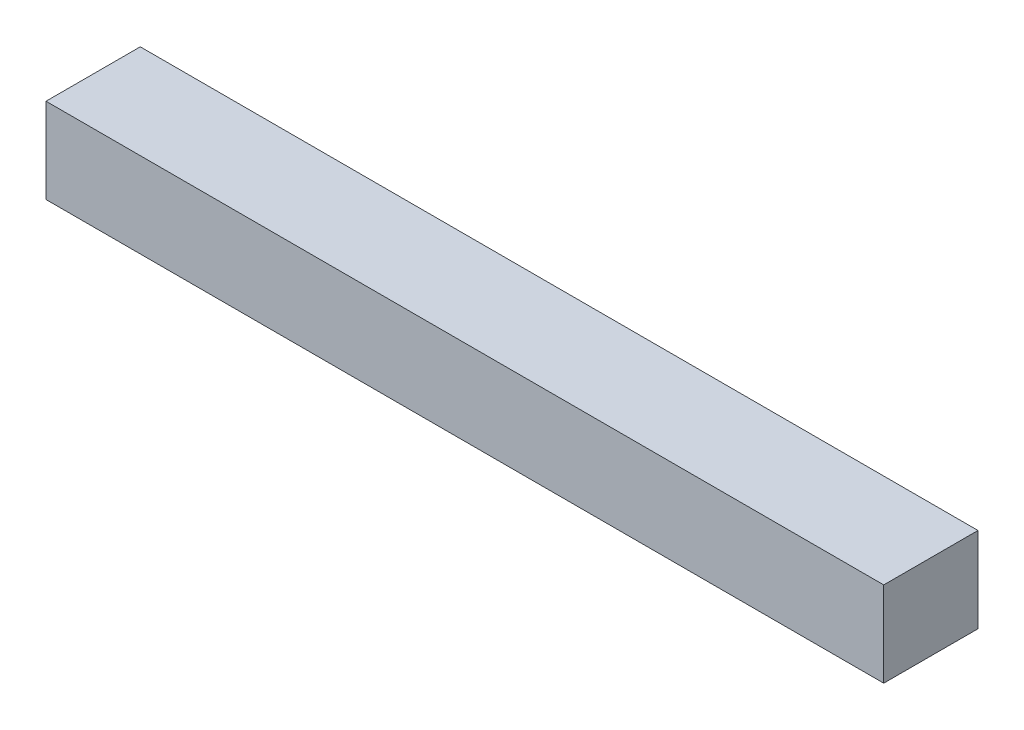
from build123d import *

# Parameters (mm, degrees)
SKETCH_1_W          = 275.5
SKETCH_1_H          = 31
EXTRUDE_1_DEPTH     = 28
CUT_EXTRUDE_START   = 6
SKETCH_1_3_W        = 263.5
SKETCH_1_3_H        = 19
CUT_EXTRUDE_1_DEPTH = 16


with BuildPart() as part:
    # 스케치1 → 보스-돌출1 (new body)
    with BuildSketch(Plane(origin=(0, 0, 0), x_dir=(1, 0, 0), z_dir=(0, 1, 0))):
        Rectangle(SKETCH_1_W, SKETCH_1_H)
    extrude(amount=EXTRUDE_1_DEPTH)

    # 스케치1<3> → 컷-돌출1 (cut)
    with BuildSketch(Plane(origin=(0, 0, 0), x_dir=(1, 0, 0), z_dir=(0, 1, 0)).offset(CUT_EXTRUDE_START)):
        Rectangle(SKETCH_1_3_W, SKETCH_1_3_H)
    extrude(amount=CUT_EXTRUDE_1_DEPTH, mode=Mode.SUBTRACT)


solid = part.part
